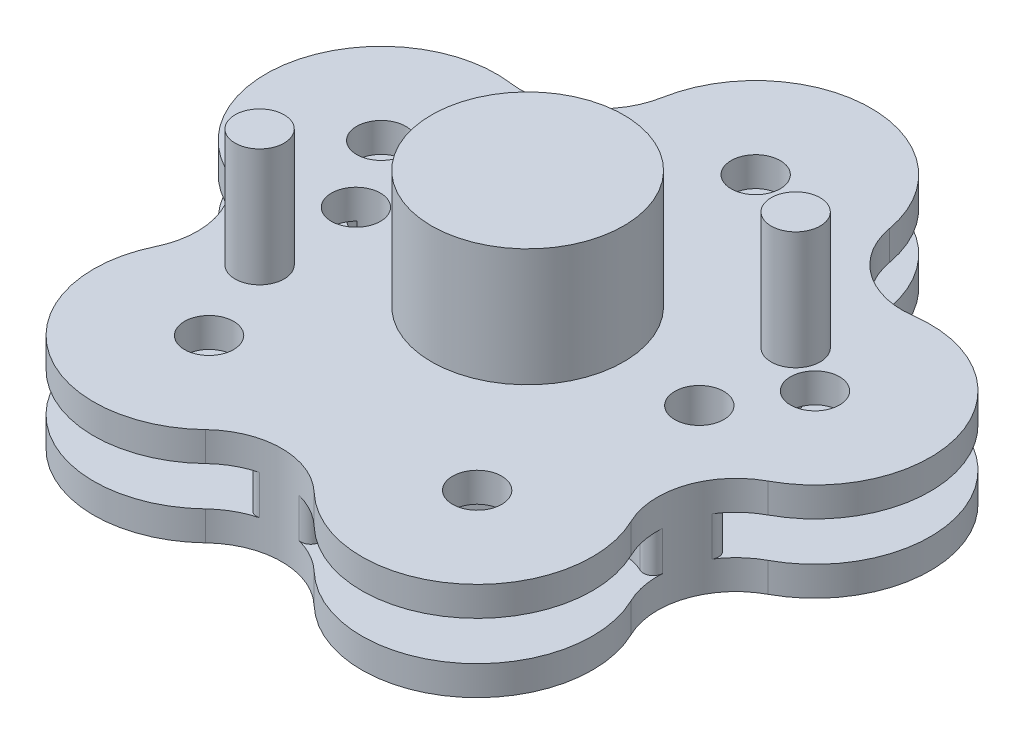
from build123d import *

# Parameters (mm, degrees)
SALIENTE_EXTRUIR1_DEPTH    = 10
CROQUIS2_R                 = 2.5
CORTAR_EXTRUIR1_DEPTH      = 10
CROQUIS3_R                 = 9.8
SALIENTE_EXTRUIR2_DEPTH    = 12
CROQUIS4_W                 = 17.653456823
CROQUIS4_H                 = 4
CORTAR_EXTRUIR2_DEPTH      = 11.5
CORTAR_EXTRUIR3_DEPTH      = 62.373730343
CORTAR_EXTRUIR3_DEPTH_BACK = 62.373730343
CROQUIS5_W                 = 3.232473087
CROQUIS5_H                 = 4
REDONDEO1_R                = 1
REDONDEO2_R                = 5
MATRIZC7_COUNT             = 5
REDONDEO3_R                = 1
REDONDEO4_R                = 5
CORTAR_EXTRUIR4_DEPTH      = 54.438308108
CORTAR_EXTRUIR4_DEPTH_BACK = 6
CROQUIS7_W                 = 6.922650149
CROQUIS7_H                 = 26.338104106
REDONDEO5_R                = 3
CROQUIS9_R                 = 2.5
CORTAR_EXTRUIR5_DEPTH      = 22
CROQUIS10_R                = 2.5
SALIENTE_EXTRUIR3_DEPTH    = 12


with BuildPart() as part:
    # Croquis1 → Saliente-Extruir1 (new body)
    with BuildSketch(Plane(origin=(0, 0, 0), x_dir=(1, 0, 0), z_dir=(0, 1, 0))):
        with BuildLine():
            ThreePointArc((11.567553172, 25.331412183), (0, 35), (-11.567553172, 25.331412183))
            ThreePointArc((-11.567553172, 25.331412183), (-14.736015149, 20.282384831), (-20.51703411, 18.829233678))
            ThreePointArc((-20.51703411, 18.829233678), (-33.28697807, 10.815594803), (-27.666175138, -3.173559966))
            ThreePointArc((-27.666175138, -3.173559966), (-23.843373369, -7.747181632), (-24.247777601, -13.694305788))
            ThreePointArc((-24.247777601, -13.694305788), (-20.57248383, -28.315594803), (-5.531083401, -27.292780108))
            ThreePointArc((-5.531083401, -27.292780108), (0, -25.070406396), (5.531083401, -27.292780108))
            ThreePointArc((5.531083401, -27.292780108), (20.57248383, -28.315594803), (24.247777601, -13.694305788))
            ThreePointArc((24.247777601, -13.694305788), (23.843373369, -7.747181632), (27.666175138, -3.173559966))
            ThreePointArc((27.666175138, -3.173559966), (33.28697807, 10.815594803), (20.51703411, 18.829233678))
            ThreePointArc((20.51703411, 18.829233678), (14.736015149, 20.282384831), (11.567553172, 25.331412183))
        make_face()
    extrude(amount=SALIENTE_EXTRUIR1_DEPTH)

    # Croquis2 → Cortar-Extruir1 (cut)
    with BuildSketch(Plane(origin=(0, 10, 0), x_dir=(1, 0, 0), z_dir=(0, 1, 0))):
        with Locations(Location((-22.108224643, 7.183397635, 0), (0, 0, 270))):
            Circle(CROQUIS2_R)
        with Locations(Location((0, 23.245963057, 0), (0, 0, 270))):
            Circle(CROQUIS2_R)
        with Locations(Location((22.108224643, 7.183397635, 0), (0, 0, 270))):
            Circle(CROQUIS2_R)
        with Locations(Location((13.66363426, -18.806379164, 0), (0, 0, 270))):
            Circle(CROQUIS2_R)
        with Locations(Location((-13.66363426, -18.806379164, 0), (0, 0, 270))):
            Circle(CROQUIS2_R)
    extrude(amount=-CORTAR_EXTRUIR1_DEPTH, mode=Mode.SUBTRACT)

    # Croquis3 → Saliente-Extruir2 (add)
    with BuildSketch(Plane(origin=(0, 10, 0), x_dir=(1, 0, 0), z_dir=(0, 1, 0))):
        with Locations(Location((0, 0, 0), (0, 0, 270))):
            Circle(CROQUIS3_R)
    extrude(amount=SALIENTE_EXTRUIR2_DEPTH)

    # Croquis4 → Cortar-Extruir2 (cut, symmetric)
    with BuildSketch(Plane(origin=(0, 0, 0), x_dir=(0, 0, -1), z_dir=(1, 0, 0))):
        with Locations((27.65596209, 5)):
            Rectangle(CROQUIS4_W, CROQUIS4_H)
    cortar_extruir2 = extrude(amount=CORTAR_EXTRUIR2_DEPTH, both=True, mode=Mode.SUBTRACT)

    # Croquis5 → Cortar-Extruir3 (cut, two sides: drawn at the far end of the back side and taken through both)
    with BuildSketch(Plane.ZY.offset(-11.5).offset(-CORTAR_EXTRUIR3_DEPTH_BACK)):
        with Locations((-24.060237665, 5)):
            Rectangle(CROQUIS5_W, CROQUIS5_H)
    extrude(amount=CORTAR_EXTRUIR3_DEPTH + CORTAR_EXTRUIR3_DEPTH_BACK, mode=Mode.SUBTRACT)

    # Redondeo1
    # the kernel refuses this fillet: 1 mm, written as the material it takes off along each edge
    with BuildSketch(Plane(origin=(11.5, 3, -22.444001121), x_dir=(1, 0, 0), z_dir=(0, 1, 0)), Plane(origin=(-11.5, 3, -22.444001121), x_dir=(0, 0, 1), z_dir=(0, 1, 0))) as redondeo1_piece_1:
        with BuildLine():
            CenterArc((REDONDEO1_R, -REDONDEO1_R), REDONDEO1_R, 90, 90)
            Line((0, -REDONDEO1_R), (0, 0))
            Line((0, 0), (REDONDEO1_R, 0))
        make_face()
    extrude(amount=4, mode=Mode.SUBTRACT)
    with BuildSketch(Plane(origin=(12.699385644, 7, -22.444001121), x_dir=(-1, 0, 0), z_dir=(0, -1, 0))) as redondeo1_piece_2:
        with BuildLine():
            CenterArc((0.526987375, -1), REDONDEO1_R, 90, 53.849058394)
            ThreePointArc((-0.280478336, -0.410085493), (-0.137052587, -0.207222212), (0, 0))
            Line((0, 0), (0.526987375, 0))
        make_face()
    extrude(amount=4, mode=Mode.SUBTRACT)
    with BuildSketch(Plane(origin=(-12.699385644, 7, -22.444001121), x_dir=(1, 0, 0), z_dir=(0, -1, 0))) as redondeo1_piece_3:
        with BuildLine():
            CenterArc((0.526987375, 1), REDONDEO1_R, 216.150941606, 53.849058394)
            ThreePointArc((-0.280478336, 0.410085493), (-0.137052587, 0.207222212), (0, 0))
            Line((0, 0), (0.526987375, 0))
        make_face()
    extrude(amount=4, mode=Mode.SUBTRACT)

    # Redondeo2
    redondeo2_edges = [part.edges().sort_by_distance(p)[0] for p in [
        (-11.5, 5, -18.829233678),
        (11.5, 5, -18.829233678),
    ]]
    fillet(redondeo2_edges, radius=REDONDEO2_R)

    # MatrizC7: Cortar-Extruir2 ×5 about axis
    matrizc7_axis = Axis((0, 0, 0), (0, 1, 0))
    for i in range(1, MATRIZC7_COUNT):
        add(cortar_extruir2.rotate(matrizc7_axis, i * 360 / MATRIZC7_COUNT), mode=Mode.SUBTRACT)

    # Redondeo3
    # the kernel refuses this fillet: 1 mm, written as the material it takes off along each edge
    with BuildSketch(Plane(origin=(27.973473546, 7, 3.002683051), x_dir=(-0.745583502081635, 0, 0.6664122158421801), z_dir=(0, -1, 0)), Plane(origin=(5.788557435, 7, 27.532234391), x_dir=(-0.864193653284182, 0, -0.5031593481426527), z_dir=(0, -1, 0)), Plane(origin=(-24.395948306, 7, 14.013173589), x_dir=(0.21148245149008985, 0, -0.9773817947515403), z_dir=(0, -1, 0)), Plane(origin=(-20.866082676, 7, -18.871616823), x_dir=(0.9948969963292142, 0, -0.10089582099922498), z_dir=(0, -1, 0))) as redondeo3_piece_1:
        with BuildLine():
            CenterArc((4.661949033, 0.96239971), REDONDEO3_R, 113.790758155, 140.447525624)
            Line((4.258551325, 1.877424458), (4.218211554, 1.968926933))
            Line((4.218211554, 1.968926933), (-0.040339771, 0.091502475))
            Line((-0.040339771, 0.091502475), (0.020546947, -0.097866353))
            ThreePointArc((0.020546947, -0.097866353), (0.366456105, -0.019823583), (4.363148054, -0.096239971))
            Line((4.363148054, -0.096239971), (4.390311779, 0))
        make_face()
    extrude(amount=4, mode=Mode.SUBTRACT)
    with BuildSketch(Plane(origin=(20.866082676, 7, -18.871616823), x_dir=(-0.9948969963292025, 0, -0.10089582099933926), z_dir=(0, -1, 0)), Plane(origin=(24.395948306, 7, 14.013173589), x_dir=(-0.2114824514899068, 0, -0.9773817947515798), z_dir=(0, -1, 0)), Plane(origin=(-5.788557435, 7, 27.532234391), x_dir=(0.8641936532842898, 0, -0.5031593481424677), z_dir=(0, -1, 0)), Plane(origin=(-27.973473546, 7, 3.002683051), x_dir=(0.7455835020815682, 0, 0.666412215842255), z_dir=(0, -1, 0))) as redondeo3_piece_2:
        with BuildLine():
            CenterArc((4.661949033, -0.96239971), REDONDEO3_R, 105.761716221, 140.447525624)
            Line((4.258551325, -1.877424458), (4.218211554, -1.968926933))
            Line((4.218211554, -1.968926933), (-0.040339771, -0.091502475))
            Line((-0.040339771, -0.091502475), (0.020546947, 0.097866353))
            ThreePointArc((0.020546947, 0.097866353), (0.366456105, 0.019823583), (4.363148054, 0.096239971))
            Line((4.363148054, 0.096239971), (4.390311779, 0))
        make_face()
    extrude(amount=4, mode=Mode.SUBTRACT)

    # Redondeo4
    redondeo4_edges = [part.edges().sort_by_distance(p)[0] for p in [
        (14.353969951, 5, -16.755703135),
        (21.461360822, 5, 5.11859674),
        (20.371241303, 5, 8.473639636),
        (1.763850433, 5, 21.992700438),
        (-1.763850433, 5, 21.992700438),
        (-20.371241303, 5, 8.473639636),
        (-21.461360822, 5, 5.11859674),
        (-14.353969951, 5, -16.755703135),
    ]]
    fillet(redondeo4_edges, radius=REDONDEO4_R)

    # Croquis7 → Cortar-Extruir4 (cut, two sides: drawn at the far end of the back side and taken through both)
    with BuildSketch(Plane.XZ.offset(-CORTAR_EXTRUIR4_DEPTH_BACK)):
        with Locations((-6.630731168, 0)):
            Rectangle(CROQUIS7_W, CROQUIS7_H)
        with Locations((7.131163709, 0)):
            Rectangle(CROQUIS7_W, CROQUIS7_H)
    extrude(amount=CORTAR_EXTRUIR4_DEPTH + CORTAR_EXTRUIR4_DEPTH_BACK, mode=Mode.SUBTRACT)

    # Redondeo5
    redondeo5_edges = [part.edges().sort_by_distance(p)[0] for p in [
        (-6.630731167, 6, -13.169052053),
        (-3.169406093, 6, 0),
        (-6.630731167, 6, 13.169052053),
        (3.669838634, 6, 0),
        (7.131163708, 6, -13.169052053),
        (7.131163708, 6, 13.169052053),
    ]]
    fillet(redondeo5_edges, radius=REDONDEO5_R)

    # Croquis9 → Cortar-Extruir5 (cut)
    with BuildSketch(Plane(origin=(0, 22, 0), x_dir=(1, 0, 0), z_dir=(0, 1, 0))):
        with Locations(Location((17.5, 0, 0), (0, 0, 270))):
            Circle(CROQUIS9_R)
        with Locations(Location((-17.5, 0, 0), (0, 0, 270))):
            Circle(CROQUIS9_R)
    extrude(amount=-CORTAR_EXTRUIR5_DEPTH, mode=Mode.SUBTRACT)

    # Croquis10 → Saliente-Extruir3 (add)
    with BuildSketch(Plane(origin=(0, 10, 0), x_dir=(1, 0, 0), z_dir=(0, 1, 0))):
        with Locations(Location((17.320508076, 10, 0), (0, 0, 270))):
            Circle(CROQUIS10_R)
        with Locations(Location((-17.320508076, -10, 0), (0, 0, 270))):
            Circle(CROQUIS10_R)
    extrude(amount=SALIENTE_EXTRUIR3_DEPTH)


solid = part.part
